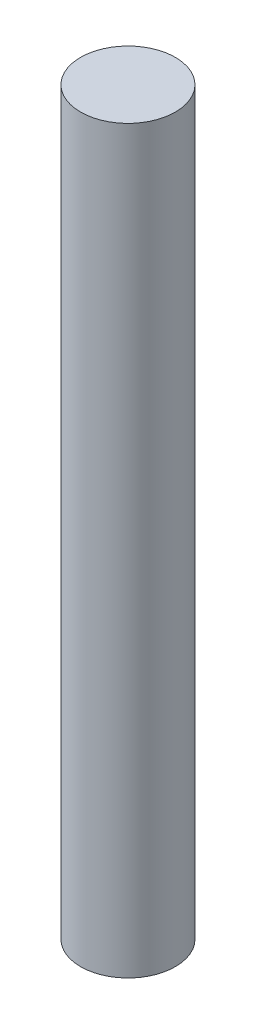
from build123d import *

# Parameters (mm, degrees)
SKETCH1_R           = 3.96875
BOSS_EXTRUDE1_DEPTH = 61.976
SCALE1_SCALE        = 0.75


with BuildPart() as part:
    # Sketch1 → Boss-Extrude1 (new body)
    with BuildSketch(Plane(origin=(0, 0, 0), x_dir=(1, 0, 0), z_dir=(0, 1, 0))):
        Circle(SKETCH1_R)
    extrude(amount=BOSS_EXTRUDE1_DEPTH)


with BuildPart() as part_1:
    # Scale1: scaled about (0, 30.988, 0)
    add(part.part.scale(SCALE1_SCALE).moved(Location((0, 7.747, 0))))


solid = part_1.part
